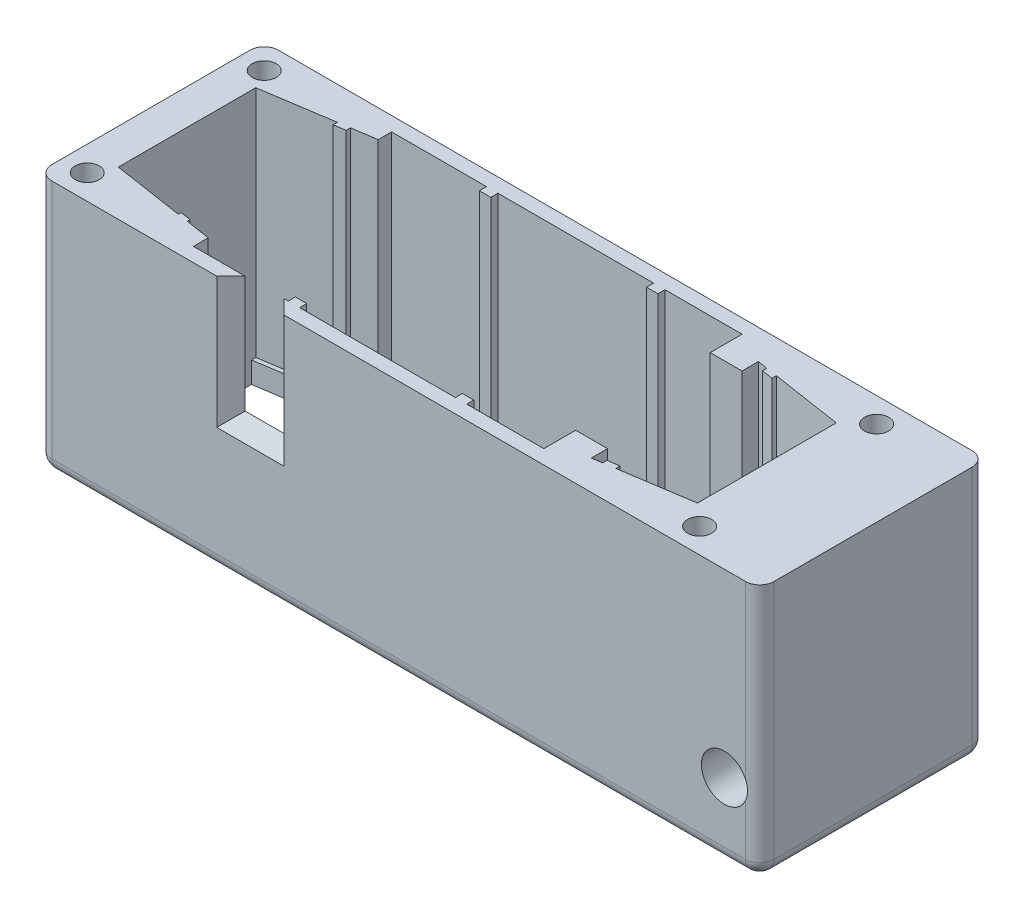
from build123d import *

# Parameters (mm, degrees)
SKETCH1_W                                            = 102
SKETCH1_H                                            = 32
MAIN_BODY_DEPTH                                      = 36
CLIP_CLEARANCE_DEPTH                                 = 33
SKETCH4_W                                            = 4.5
SKETCH4_H                                            = 4.5
CLIP_GUIDE_DEPTH                                     = 36
CLIP_WINDOW_REACH                                    = 73.884
SKETCH22_W                                           = 4.5
SKETCH22_H                                           = 16
SKETCH5_W                                            = 12
SKETCH5_H                                            = 6
LOCK_CLEARANCE_DEPTH                                 = 18.5
SKETCH7_W                                            = 12
SKETCH7_H                                            = 16.82
LOCK_MECH_CLEARANCE_DEPTH                            = 10
LOCK_MECH_COVER_DEPTH                                = 12
SKETCH28_W                                           = 1
SKETCH28_H                                           = 6
LOCK_SLIDE_CLEARANCE_DEPTH                           = 13.8
LOCK_LEVER_SPACE_DEPTH                               = 12
CBORE_FOR_M3_HEX_SOCKET_THIN_HEAD_CAP_SC_D           = 3.2
CBORE_FOR_M3_HEX_SOCKET_THIN_HEAD_CAP_SC_DEPTH       = 11
CBORE_FOR_M3_HEX_SOCKET_THIN_HEAD_CAP_SC_CBORE_D     = 6.5
CBORE_FOR_M3_HEX_SOCKET_THIN_HEAD_CAP_SC_CBORE_DEPTH = 7.4
CBORE_FOR_M3_HEX_SOCKET_THIN_HEAD_CAP_SC_TIP         = 0.96137699
CBORE_FOR_M3_HEX_SOCKET_THIN_HEAD_CA_2_A_COUNT       = 2
CBORE_FOR_M3_HEX_SOCKET_THIN_HEAD_CA_2_A_PITCH       = 86.5
CBORE_FOR_M3_HEX_SOCKET_THIN_HEAD_CA_3_COUNT         = 2
CBORE_FOR_M3_HEX_SOCKET_THIN_HEAD_CA_3_PITCH         = 90.040268769
CBORE_FOR_M3_HEX_SOCKET_THIN_HEAD_CA_4_COUNT         = 2
CBORE_FOR_M3_HEX_SOCKET_THIN_HEAD_CA_4_PITCH         = 25
FILLET3_R                                            = 2
CHAMFER1_SIZE                                        = 1
CHAMFER2_SIZE                                        = 2.5
FILLET2_R                                            = 2
M3_TAPPED_HOLE1_D                                    = 2.5
M3_TAPPED_HOLE1_DEPTH                                = 8
M3_TAPPED_HOLE1_CSINK_D                              = 3.5
M3_TAPPED_HOLE1_CSINK_ANGLE                          = 90
M3_TAPPED_HOLE1_TIP                                  = 0.751075774


with BuildPart() as part:
    # Sketch1 → main-body (new body)
    with BuildSketch(Plane(origin=(0, 0, 0), x_dir=(1, 0, 0), z_dir=(0, 1, 0))):
        with Locations((2.360033445, 8.672826087)):
            Rectangle(SKETCH1_W, SKETCH1_H)
        Polygon((-28.639966555, -4.327173913), (-28.639966555, -2.827173913), (-43.639966555, -0.527173913), (-43.639966555, 17.872826087), (-28.639966555, 20.172826087), (-28.639966555, 21.672826087), (23.360033445, 21.672826087), (23.360033445, 20.172826087), (38.360033445, 17.872826087), (38.360033445, -0.527173913), (23.360033445, -2.827173913), (23.360033445, -4.327173913), align=None, mode=Mode.SUBTRACT)
    extrude(amount=MAIN_BODY_DEPTH)

    # Sketch3 → clip-clearance (cut)
    with BuildSketch(Plane(origin=(0, 36, 0), x_dir=(1, 0, 0), z_dir=(0, 1, 0))):
        Polygon((9.960033445, 22.672826087), (23.360033445, 22.672826087), (23.360033445, 20.779838443), (26.760033445, 20.258505109), (26.760033445, 19.651492754), (28.360033445, 19.40615942), (28.360033445, 20.013171776), (38.360033445, 18.479838443), (38.360033445, -1.134186269), (28.360033445, -2.667519602), (28.360033445, -2.060507246), (26.760033445, -2.30584058), (26.760033445, -2.912852935), (23.360033445, -3.434186269), (23.360033445, -5.327173913), (9.960033445, -5.327173913), (9.960033445, -4.327173913), (8.360033445, -4.327173913), (8.360033445, -5.327173913), (-13.639966555, -5.327173913), (-13.639966555, -4.327173913), (-15.239966555, -4.327173913), (-15.239966555, -5.327173913), (-28.639966555, -5.327173913), (-28.639966555, -4.127173913), (-28.636527031, -3.234713662), (-32.139966555, -2.697519602), (-32.139966555, -2.090507246), (-33.639966555, -1.860507246), (-33.639966555, -2.467519602), (-43.639966555, -0.934186269), (-43.639966555, 18.479838443), (-33.639966555, 20.013171776), (-33.639966555, 19.40615942), (-32.039966555, 19.651492754), (-32.039966555, 20.258505109), (-28.636527031, 20.780365836), (-28.639966555, 21.672826087), (-28.639966555, 22.672826087), (-15.239966555, 22.672826087), (-15.239966555, 21.672826087), (-13.639966555, 21.672826087), (-13.639966555, 22.672826087), (8.360033445, 22.672826087), (8.360033445, 21.672826087), (9.960033445, 21.672826087), align=None)
    extrude(amount=-CLIP_CLEARANCE_DEPTH, mode=Mode.SUBTRACT)

    # Sketch4 → clip-guide (add)
    with BuildSketch(Plane(origin=(0, 0, 0), x_dir=(1, 0, 0), z_dir=(0, 1, 0))):
        with Locations((23.107275393, 20.422826087)):
            Rectangle(SKETCH4_W, SKETCH4_H)
        with Locations((23.107275393, -3.077173913)):
            Rectangle(SKETCH4_W, SKETCH4_H)
    extrude(amount=CLIP_GUIDE_DEPTH)

    # Sketch22 → clip-window (cut, up to next)
    with BuildSketch(Plane.XY.offset(7.327173913), mode=Mode.PRIVATE) as clip_window_sk1:
        with Locations((-18.589966555, 28)):
            Rectangle(SKETCH22_W, SKETCH22_H)
    clip_window_tool1 = extrude(clip_window_sk1.sketch, amount=-CLIP_WINDOW_REACH, mode=Mode.PRIVATE) & part.part
    add(clip_window_tool1.solids().sort_by_distance((-18.589967, 28, 7.327174))[0], mode=Mode.SUBTRACT)

    # Sketch5 → lock_clearance (cut)
    with BuildSketch(Plane(origin=(53.360033445, 0, 0), x_dir=(0, 0, -1), z_dir=(1, 0, 0))):
        with Locations((8.672826087, 19.82)):
            Rectangle(SKETCH5_W, SKETCH5_H)
    extrude(amount=-LOCK_CLEARANCE_DEPTH, mode=Mode.SUBTRACT)

    # Sketch7 → lock_mech_clearance (cut)
    with BuildSketch(Plane(origin=(53.360033445, 0, 0), x_dir=(0, 0, -1), z_dir=(1, 0, 0))):
        with Locations((8.672826087, 8.41)):
            Rectangle(SKETCH7_W, SKETCH7_H)
    extrude(amount=-LOCK_MECH_CLEARANCE_DEPTH, mode=Mode.SUBTRACT)

    # Sketch26 → lock_mech_cover (add)
    with BuildSketch(Plane.XY.offset(-14.672826087)):
        Polygon((53.360033445, 22.82), (53.360033445, 0), (50.860033445, 0), (50.860033445, 1.20042692), (52.160033445, 2.50042692), (52.160033445, 22.82), align=None)
    extrude(amount=LOCK_MECH_COVER_DEPTH)

    # Sketch28 → lock_slide_clearance (cut)
    with BuildSketch(Plane.ZY.offset(-38.360033445)):
        with Locations((-15.172826087, 19.82)):
            Rectangle(SKETCH28_W, SKETCH28_H)
        with Locations((-2.172826087, 19.82)):
            Rectangle(SKETCH28_W, SKETCH28_H)
    extrude(amount=-LOCK_SLIDE_CLEARANCE_DEPTH, mode=Mode.SUBTRACT)

    # Sketch27 → lock lever space (cut)
    with BuildSketch(Plane.XY.offset(-14.672826087)):
        Polygon((43.360033445, 0), (43.360033445, 4.5), (41.62570543, 0), align=None)
    extrude(amount=LOCK_LEVER_SPACE_DEPTH, mode=Mode.SUBTRACT)

    # CBORE for M3 Hex Socket Thin Head Cap Sc
    with Locations(Plane.XY.offset(7.327173913)):
        with Locations((48.360033445, 10.5)):
            CounterBoreHole(CBORE_FOR_M3_HEX_SOCKET_THIN_HEAD_CAP_SC_D / 2, CBORE_FOR_M3_HEX_SOCKET_THIN_HEAD_CAP_SC_CBORE_D / 2, CBORE_FOR_M3_HEX_SOCKET_THIN_HEAD_CAP_SC_CBORE_DEPTH, depth=CBORE_FOR_M3_HEX_SOCKET_THIN_HEAD_CAP_SC_DEPTH)
            with Locations((0, 0, -(CBORE_FOR_M3_HEX_SOCKET_THIN_HEAD_CAP_SC_DEPTH + CBORE_FOR_M3_HEX_SOCKET_THIN_HEAD_CAP_SC_TIP / 2))):  # 118° drill point
                Cone(0, CBORE_FOR_M3_HEX_SOCKET_THIN_HEAD_CAP_SC_D / 2, CBORE_FOR_M3_HEX_SOCKET_THIN_HEAD_CAP_SC_TIP, mode=Mode.SUBTRACT)

    # Sketch8 → CBORE for M3 Hex Socket Thin Head Ca 2 (revolve, cut)
    with BuildSketch(Plane(origin=(-45.139966555, 0, 3.827173913), x_dir=(0, 0, -1), z_dir=(1, 0, 0))):
        Polygon((0, 0), (0, 36), (1.7, 36), (1.7, 18.225), (1.725, 18.2), (2.9, 18.2), (2.9, 0), align=None)
    cbore_for_m3_hex_socket_thin_head_ca_2 = revolve(axis=Axis((-45.139966555, -6.35, 3.827173913), (0, 1, 0)), mode=Mode.SUBTRACT)

    # CBORE for M3 Hex Socket Thin Head Ca 2 a: CBORE for M3 Hex Socket Thin Head Ca 2 ×2
    with Locations(*[(i * CBORE_FOR_M3_HEX_SOCKET_THIN_HEAD_CA_2_A_PITCH, 0, 0) for i in range(1, CBORE_FOR_M3_HEX_SOCKET_THIN_HEAD_CA_2_A_COUNT)]):
        add(cbore_for_m3_hex_socket_thin_head_ca_2, mode=Mode.SUBTRACT)

    # CBORE for M3 Hex Socket Thin Head Ca 3: CBORE for M3 Hex Socket Thin Head Ca 2 ×2
    with Locations(*[Vector(0.9606812727523512, 0, -0.27765354703825174) * (i * CBORE_FOR_M3_HEX_SOCKET_THIN_HEAD_CA_3_PITCH) for i in range(1, CBORE_FOR_M3_HEX_SOCKET_THIN_HEAD_CA_3_COUNT)]):
        add(cbore_for_m3_hex_socket_thin_head_ca_2, mode=Mode.SUBTRACT)

    # CBORE for M3 Hex Socket Thin Head Ca 4: CBORE for M3 Hex Socket Thin Head Ca 2 ×2
    with Locations(*[(0, 0, -i * CBORE_FOR_M3_HEX_SOCKET_THIN_HEAD_CA_4_PITCH) for i in range(1, CBORE_FOR_M3_HEX_SOCKET_THIN_HEAD_CA_4_COUNT)]):
        add(cbore_for_m3_hex_socket_thin_head_ca_2, mode=Mode.SUBTRACT)

    # Fillet3
    # the kernel refuses this fillet: 2 mm, written as the material it takes off along each edge
    with BuildSketch(Plane(origin=(-53.639966555, 0, -24.672826087), x_dir=(0, 1, 0), z_dir=(1, 0, 0))) as fillet3_piece_1:
        with BuildLine():
            CenterArc((FILLET3_R, FILLET3_R), FILLET3_R, 180, 90)
            Line((0, FILLET3_R), (0, 0))
            Line((0, 0), (FILLET3_R, 0))
        make_face()
    extrude(amount=112, mode=Mode.SUBTRACT)
    with BuildSketch(Plane(origin=(58.360033445, 0, 7.327173913), x_dir=(0, 0, -1), z_dir=(-1, 0, 0))) as fillet3_piece_2:
        with BuildLine():
            CenterArc((FILLET3_R, -FILLET3_R), FILLET3_R, 90, 90)
            Line((0, -FILLET3_R), (0, 0))
            Line((0, 0), (FILLET3_R, 0))
        make_face()
    extrude(amount=112, mode=Mode.SUBTRACT)

    # Chamfer1
    chamfer1_edges = [part.edges().sort_by_distance(p)[0] for p in [
        (20.857275393, 0, -19.922826087),
        (25.357275393, 0, -19.019704204),
        (20.857275393, 0, 2.577173913),
        (25.357275393, 0, 1.67405203),
    ]]
    chamfer(chamfer1_edges, length=CHAMFER1_SIZE)

    # Chamfer2
    # the kernel refuses this chamfer: 2.5 mm, written as the material it takes off along each edge
    with BuildSketch(Plane(origin=(-20.839966555, 42.42920747, 7.327173913), x_dir=(-0.9996219169112968, 0, 0.027495876610586317), z_dir=(0, -1, 0)), Plane(origin=(-16.339966555, 20, 7.327173913), x_dir=(0.9996219169112968, 0, 0.027495876610586317), z_dir=(0, 1, 0))) as chamfer2_piece_1:
        Polygon((CHAMFER2_SIZE * 0.999621916911, CHAMFER2_SIZE * 0.0274958766106), (-CHAMFER2_SIZE * 0.0274958766106, CHAMFER2_SIZE * 0.999621916911), (0, 0), align=None)
    extrude(amount=22.42920747, mode=Mode.SUBTRACT)
    with BuildSketch(Plane(origin=(-20.839966555, 20, 7.327173913), x_dir=(0, -0.9996219169112968, 0.027495876610586317), z_dir=(1, 0, 0))) as chamfer2_piece_2:
        Polygon((CHAMFER2_SIZE * 0.999621916911, CHAMFER2_SIZE * 0.0274958766106), (-CHAMFER2_SIZE * 0.0274958766106, CHAMFER2_SIZE * 0.999621916911), (0, 0), align=None)
    extrude(amount=4.5, mode=Mode.SUBTRACT)
    with BuildSketch(Plane(origin=(-20.839966555, 42.42920747, 7.327173913), x_dir=(-0.9996219169112968, 0, 0.027495876610586317), z_dir=(0, -1, 0))) as chamfer2_piece_3a_section:
        Polygon((CHAMFER2_SIZE * 0.999621916911, CHAMFER2_SIZE * 0.0274958766106), (-CHAMFER2_SIZE * 0.0274958766106, CHAMFER2_SIZE * 0.999621916911), (0, 0), align=None)
    chamfer2_piece_3a = extrude(amount=28.85841494, mode=Mode.PRIVATE)
    chamfer2_piece_3a = split(chamfer2_piece_3a, bisect_by=Plane(origin=(-21.664450622, 20, 6.502689846), z_dir=(0, -1, 0)), keep=Keep.TOP, mode=Mode.PRIVATE)
    with BuildSketch(Plane(origin=(-27.269174025, 20, 7.327173913), x_dir=(0, -0.9996219169112968, 0.027495876610586317), z_dir=(1, 0, 0))) as chamfer2_piece_3b_section:
        Polygon((CHAMFER2_SIZE * 0.999621916911, CHAMFER2_SIZE * 0.0274958766106), (-CHAMFER2_SIZE * 0.0274958766106, CHAMFER2_SIZE * 0.999621916911), (0, 0), align=None)
    chamfer2_piece_3b = extrude(amount=10.92920747, mode=Mode.PRIVATE)
    chamfer2_piece_3b = split(chamfer2_piece_3b, bisect_by=Plane(origin=(-20.839966555, 19.175515933, 6.502689846), z_dir=(-1, 0, 0)), keep=Keep.TOP, mode=Mode.PRIVATE)
    chamfer2_piece_3 = chamfer2_piece_3a & chamfer2_piece_3b
    add(chamfer2_piece_3, mode=Mode.SUBTRACT)
    with BuildSketch(Plane(origin=(-20.839966555, 20, 7.327173913), x_dir=(0, -0.9996219169112968, 0.027495876610586317), z_dir=(1, 0, 0))) as chamfer2_piece_4a_section:
        Polygon((CHAMFER2_SIZE * 0.999621916911, CHAMFER2_SIZE * 0.0274958766106), (-CHAMFER2_SIZE * 0.0274958766106, CHAMFER2_SIZE * 0.999621916911), (0, 0), align=None)
    chamfer2_piece_4a = extrude(amount=10.92920747, mode=Mode.PRIVATE)
    chamfer2_piece_4a = split(chamfer2_piece_4a, bisect_by=Plane(origin=(-16.339966555, 19.175515933, 6.502689846), z_dir=(1, 0, 0)), keep=Keep.TOP, mode=Mode.PRIVATE)
    with BuildSketch(Plane(origin=(-16.339966555, 13.57079253, 7.327173913), x_dir=(0.9996219169112968, 0, 0.027495876610586317), z_dir=(0, 1, 0))) as chamfer2_piece_4b_section:
        Polygon((CHAMFER2_SIZE * 0.999621916911, CHAMFER2_SIZE * 0.0274958766106), (-CHAMFER2_SIZE * 0.0274958766106, CHAMFER2_SIZE * 0.999621916911), (0, 0), align=None)
    chamfer2_piece_4b = extrude(amount=28.85841494, mode=Mode.PRIVATE)
    chamfer2_piece_4b = split(chamfer2_piece_4b, bisect_by=Plane(origin=(-15.515482488, 20, 6.502689846), z_dir=(0, -1, 0)), keep=Keep.TOP, mode=Mode.PRIVATE)
    chamfer2_piece_4 = chamfer2_piece_4a & chamfer2_piece_4b
    add(chamfer2_piece_4, mode=Mode.SUBTRACT)

    # Fillet2
    # the kernel refuses this fillet: 2 mm, written as the material it takes off along each edge
    with BuildSketch(Plane(origin=(-48.639966555, 2, -24.672826087), x_dir=(1, 0, 0), z_dir=(0, 1, 0)), Plane(origin=(53.360033445, 2, 7.327173913), x_dir=(-1, 0, 0), z_dir=(0, 1, 0))) as fillet2_piece_1:
        with BuildLine():
            CenterArc((FILLET2_R, -FILLET2_R), FILLET2_R, 90, 90)
            Line((0, -FILLET2_R), (0, 0))
            Line((0, 0), (FILLET2_R, 0))
        make_face()
    extrude(amount=39, mode=Mode.SUBTRACT)
    with BuildSketch(Plane(origin=(53.360033445, 2, -24.672826087), x_dir=(-1, 0, 0), z_dir=(0, 1, 0)), Plane(origin=(-48.639966555, 2, 7.327173913), x_dir=(1, 0, 0), z_dir=(0, 1, 0))) as fillet2_piece_2:
        with BuildLine():
            CenterArc((FILLET2_R, FILLET2_R), FILLET2_R, 180, 90)
            Line((0, FILLET2_R), (0, 0))
            Line((0, 0), (FILLET2_R, 0))
        make_face()
    extrude(amount=39, mode=Mode.SUBTRACT)
    with BuildSketch(Plane(origin=(53.360033445, 0, 5.327173913), x_dir=(-1, 0, 0), z_dir=(0, 0, -1))) as fillet2_piece_3:
        with BuildLine():
            CenterArc((FILLET2_R, FILLET2_R), FILLET2_R, 180, 90)
            Line((0, FILLET2_R), (0, 0))
            Line((0, 0), (FILLET2_R, 0))
        make_face()
    extrude(amount=28, mode=Mode.SUBTRACT)
    with BuildSketch(Plane(origin=(-48.639966555, 0, 5.327173913), x_dir=(1, 0, 0), z_dir=(0, 0, -1))) as fillet2_piece_4:
        with BuildLine():
            CenterArc((FILLET2_R, -FILLET2_R), FILLET2_R, 90, 90)
            Line((0, -FILLET2_R), (0, 0))
            Line((0, 0), (FILLET2_R, 0))
        make_face()
    extrude(amount=28, mode=Mode.SUBTRACT)
    with BuildSketch(Plane(origin=(-48.639966555, 2, -22.672826087), x_dir=(0, 0, -1), z_dir=(0, 1, 0))) as fillet2_piece_5:
        with BuildLine():
            CenterArc((2 - FILLET2_R, -FILLET2_R), FILLET2_R, 0, 90)
            Line((2 - FILLET2_R, 0), (2, 0))
            Line((2, 0), (2, -FILLET2_R))
        make_face()
    revolve(axis=Axis((-48.639966555, 2, -22.672826087), (-1, 0, 0)), revolution_arc=90, mode=Mode.SUBTRACT)
    with BuildSketch(Plane(origin=(53.360033445, 2, -22.672826087), x_dir=(0, 0, -1), z_dir=(0, 1, 0))) as fillet2_piece_6:
        with BuildLine():
            CenterArc((2 - FILLET2_R, FILLET2_R), FILLET2_R, 270, 90)
            Line((2 - FILLET2_R, 0), (2, 0))
            Line((2, 0), (2, FILLET2_R))
        make_face()
    revolve(axis=Axis((53.360033445, 2, -22.672826087), (-1, 0, 0)), revolution_arc=90, mode=Mode.SUBTRACT)
    with BuildSketch(Plane(origin=(53.360033445, 2, 5.327173913), x_dir=(0, 0, 1), z_dir=(0, 1, 0))) as fillet2_piece_7:
        with BuildLine():
            CenterArc((2 - FILLET2_R, -FILLET2_R), FILLET2_R, 0, 90)
            Line((2 - FILLET2_R, 0), (2, 0))
            Line((2, 0), (2, -FILLET2_R))
        make_face()
    revolve(axis=Axis((53.360033445, 2, 5.327173913), (1, 0, 0)), revolution_arc=90, mode=Mode.SUBTRACT)
    with BuildSketch(Plane(origin=(-48.639966555, 2, 5.327173913), x_dir=(0, 0, 1), z_dir=(0, 1, 0))) as fillet2_piece_8:
        with BuildLine():
            CenterArc((2 - FILLET2_R, FILLET2_R), FILLET2_R, 270, 90)
            Line((2, FILLET2_R), (2, 0))
            Line((2, 0), (2 - FILLET2_R, 0))
        make_face()
    revolve(axis=Axis((-48.639966555, 2, 5.327173913), (1, 0, 0)), revolution_arc=90, mode=Mode.SUBTRACT)

    # M3 Tapped Hole1
    with Locations(Plane.XY.offset(-14.672826087)):
        with Locations((48.360033445, 10.5)):
            CounterSinkHole(M3_TAPPED_HOLE1_D / 2, M3_TAPPED_HOLE1_CSINK_D / 2, depth=M3_TAPPED_HOLE1_DEPTH, counter_sink_angle=M3_TAPPED_HOLE1_CSINK_ANGLE)
            with Locations((0, 0, -(M3_TAPPED_HOLE1_DEPTH + M3_TAPPED_HOLE1_TIP / 2))):  # 118° drill point
                Cone(0, M3_TAPPED_HOLE1_D / 2, M3_TAPPED_HOLE1_TIP, mode=Mode.SUBTRACT)


solid = part.part
